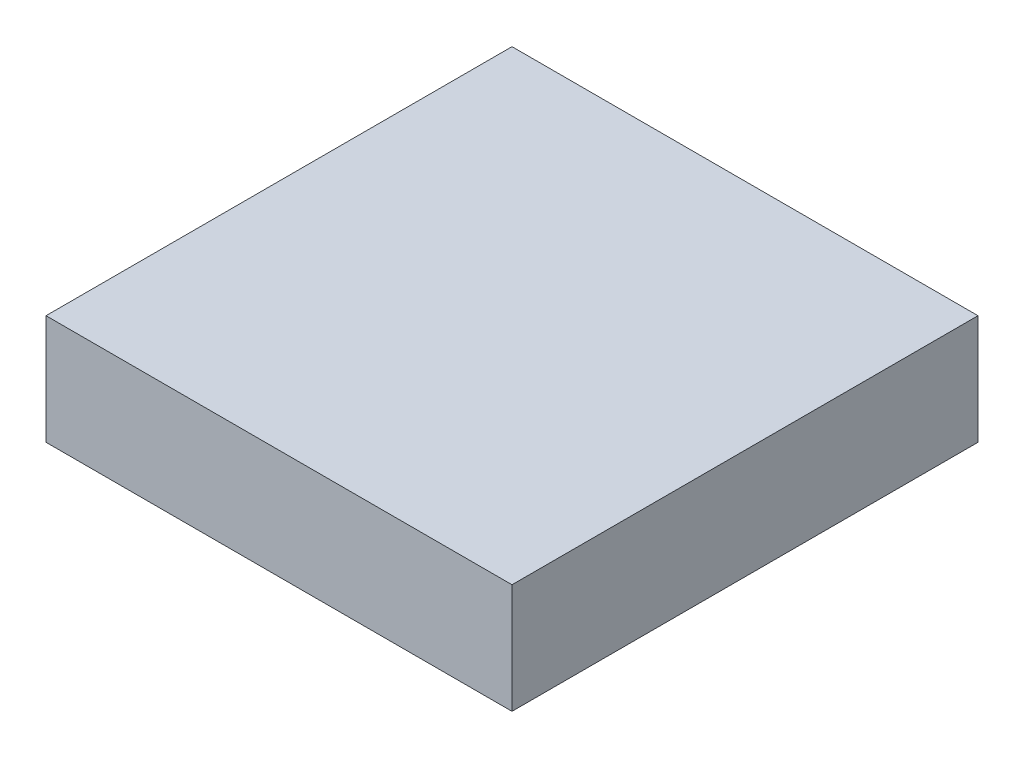
from build123d import *

# Parameters (mm, degrees)
SKETCH1_W           = 340
SKETCH1_H           = 340
BOSS_EXTRUDE1_DEPTH = 80


with BuildPart() as part:
    # Sketch1 → Boss-Extrude1 (new body)
    with BuildSketch(Plane(origin=(0, 0, 0), x_dir=(1, 0, 0), z_dir=(0, 1, 0))):
        with Locations((170, -170)):
            Rectangle(SKETCH1_W, SKETCH1_H)
    extrude(amount=BOSS_EXTRUDE1_DEPTH)


solid = part.part
